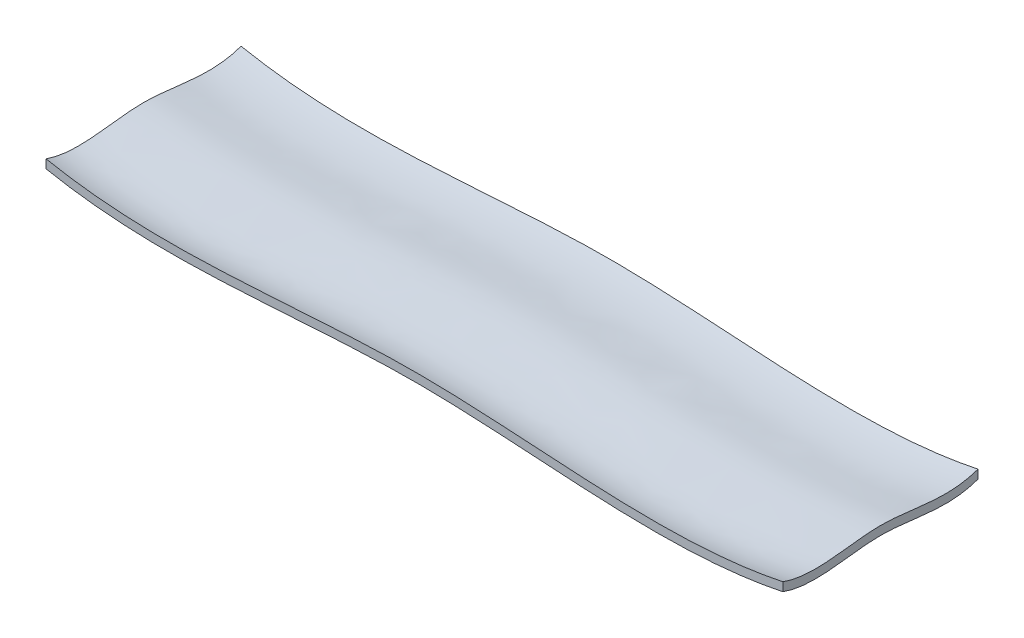
from build123d import *

# Parameters (mm, degrees)
SKETCH1_W           = 863.6
SKETCH1_H           = 228.6
BOSS_EXTRUDE1_DEPTH = 101.6


with BuildPart() as part:
    # Sketch1 → Boss-Extrude1 (new body)
    with BuildSketch(Plane(origin=(0, 0, 0), x_dir=(1, 0, 0), z_dir=(0, 1, 0))):
        Rectangle(SKETCH1_W, SKETCH1_H)
    extrude(amount=BOSS_EXTRUDE1_DEPTH)

    # Cut-Sweep7: sweep along a path in Sketch2
    with BuildLine() as cut_sweep7_path:  # in the path sketch's own coordinates; laid on its plane below (add() does not lay a ready-made edge on the line's plane)
        add(Edge.make_bspline(
            [(-431.8, 22.86), (-289.202744468, -5.282449634), (0.168695534, 50.608919723), (289.035719793, -4.495155443), (431.8, 25.4)],
            knots=[0, 0, 0, 0, 0.499926343, 1, 1, 1, 1], degree=3))
    # Sketch3 → Cut-Sweep7 (sweep, cut)
    with BuildSketch(Plane.ZY.offset(431.8)):
        with BuildLine():
            Line((-114.3, 0), (114.3, 0))
            Line((114.3, 0), (114.3, 22.86))
            add(Edge.make_bspline(
                [(-114.3, 22.86), (-76.2, 9.313333333), (0, 36.406666667), (76.2, 9.313333333), (114.3, 22.86)],
                knots=[0, 0, 0, 0, 0.5, 1, 1, 1, 1], degree=3))
            Line((-114.3, 22.86), (-114.3, 0))
        make_face()
    sweep(path=Plane.XY.offset(114.3) * cut_sweep7_path.line, mode=Mode.SUBTRACT)


with BuildPart() as cut_sweep7_kept_piece:
    # of the separate pieces the step leaves, the one the design keeps (cut_sweep7_pieces_kept)
    add(part.part.solids().sort_by_distance((-431.8, 22.86, 114.3))[0])

    # Cut-Sweep9: sweep along a path in Sketch11
    with BuildLine() as cut_sweep9_path:  # in the path sketch's own coordinates; laid on its plane below (add() does not lay a ready-made edge on the line's plane)
        add(Edge.make_bspline(
            [(-431.8, 33.02), (-289.202744468, 4.877550366), (0.168695534, 60.768919723), (289.035719793, 5.664844557), (431.8, 35.56)],
            knots=[0, 0, 0, 0, 0.499926343, 1, 1, 1, 1], degree=3))
    # Sketch10 → Cut-Sweep9 (sweep, cut)
    with BuildSketch(Plane.ZY.offset(431.8)):
        with BuildLine():
            Line((114.3, 101.6), (114.3, 33.02))
            add(Edge.make_bspline(
                [(-114.3, 33.02), (-76.2, 19.473333333), (0, 46.566666667), (76.2, 19.473333333), (114.3, 33.02)],
                knots=[0, 0, 0, 0, 0.5, 1, 1, 1, 1], degree=3))
            Line((-114.3, 33.02), (-114.3, 101.6))
            Line((-114.3, 101.6), (114.3, 101.6))
        make_face()
    sweep(path=Plane.XY.offset(114.3) * cut_sweep9_path.line, mode=Mode.SUBTRACT)


with BuildPart() as cut_sweep9_kept_piece:
    # of the separate pieces the step leaves, the one the design keeps (cut_sweep9_pieces_kept)
    add(cut_sweep7_kept_piece.part.solids().sort_by_distance((-431.8, 22.86, 114.3))[0])


solid = cut_sweep9_kept_piece.part
